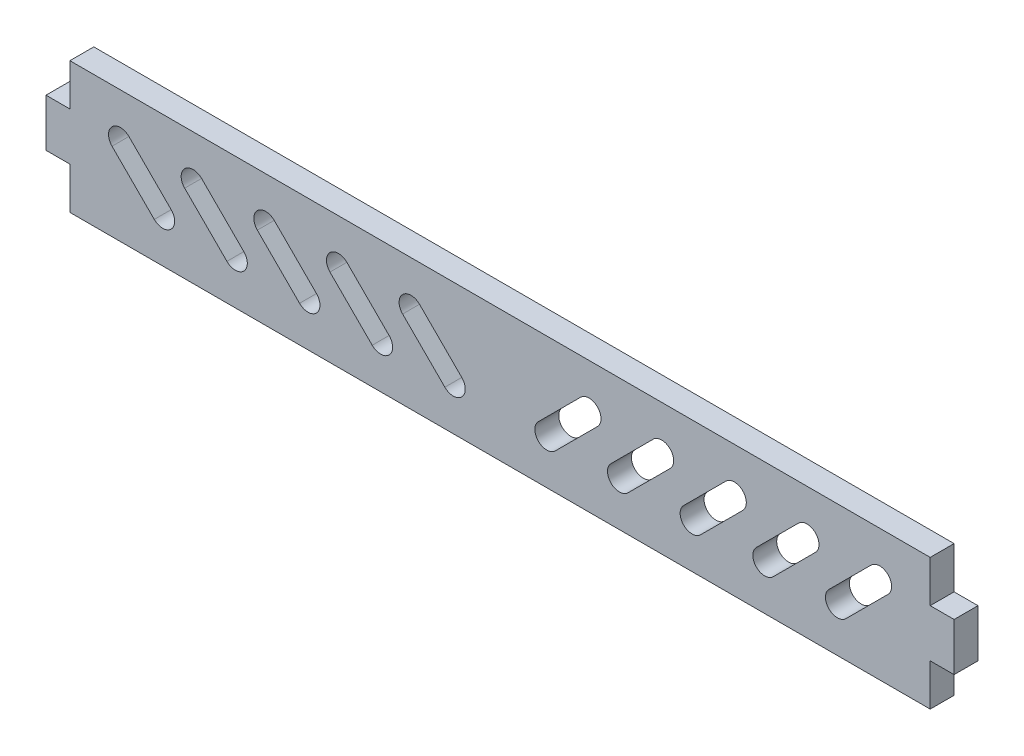
from build123d import *

# Parameters (mm, degrees)
BOSS_EXTRUDE1_DEPTH = 3.175
CUT_EXTRUDE1_DEPTH  = 119.807892511


with BuildPart() as part:
    # Sketch1 → Boss-Extrude1 (new body)
    with BuildSketch(Plane.XY):
        Polygon((0, 0), (-114.3, 0), (-114.3, 5.555107), (-117.475, 5.555107), (-117.475, 11.905107), (-114.3, 11.905107), (-114.3, 17.460214), (0, 17.460214), (0, 11.905107), (3.175, 11.905107), (3.175, 5.555107), (0, 5.555107), align=None)
    extrude(amount=BOSS_EXTRUDE1_DEPTH)

    # Sketch2 → Cut-Extrude1 (cut, through all)
    with BuildSketch(Plane.XY.offset(3.175)):
        with BuildLine():
            Line((-106.458798023, 12.658969053), (-100.846137947, 7.046308977))
            ThreePointArc((-100.846137947, 7.046308977), (-100.846137947, 4.801244947), (-103.091201977, 4.801244947))
            Line((-103.091201977, 4.801244947), (-108.703862053, 10.413905023))
            ThreePointArc((-108.703862053, 10.413905023), (-108.703862053, 12.658969053), (-106.458798023, 12.658969053))
        make_face()
        with BuildLine():
            Line((-96.806798023, 12.658969053), (-91.194137947, 7.046308977))
            ThreePointArc((-91.194137947, 7.046308977), (-91.194137947, 4.801244947), (-93.439201977, 4.801244947))
            Line((-93.439201977, 4.801244947), (-99.051862053, 10.413905023))
            ThreePointArc((-99.051862053, 10.413905023), (-99.051862053, 12.658969053), (-96.806798023, 12.658969053))
        make_face()
        with BuildLine():
            Line((-87.154798023, 12.658969053), (-81.542137947, 7.046308977))
            ThreePointArc((-81.542137947, 7.046308977), (-81.542137947, 4.801244947), (-83.787201977, 4.801244947))
            Line((-83.787201977, 4.801244947), (-89.399862053, 10.413905023))
            ThreePointArc((-89.399862053, 10.413905023), (-89.399862053, 12.658969053), (-87.154798023, 12.658969053))
        make_face()
        with BuildLine():
            Line((-77.502798023, 12.658969053), (-71.890137947, 7.046308977))
            ThreePointArc((-71.890137947, 7.046308977), (-71.890137947, 4.801244947), (-74.135201977, 4.801244947))
            Line((-74.135201977, 4.801244947), (-79.747862053, 10.413905023))
            ThreePointArc((-79.747862053, 10.413905023), (-79.747862053, 12.658969053), (-77.502798023, 12.658969053))
        make_face()
        with BuildLine():
            Line((-67.850798023, 12.658969053), (-62.238137947, 7.046308977))
            ThreePointArc((-62.238137947, 7.046308977), (-62.238137947, 4.801244947), (-64.483201977, 4.801244947))
            Line((-64.483201977, 4.801244947), (-70.095862053, 10.413905023))
            ThreePointArc((-70.095862053, 10.413905023), (-70.095862053, 12.658969053), (-67.850798023, 12.658969053))
        make_face()
        with BuildLine():
            Line((-46.449201977, 12.658969053), (-52.061862053, 7.046308977))
            ThreePointArc((-52.061862053, 7.046308977), (-52.061862053, 4.801244947), (-49.816798023, 4.801244947))
            Line((-49.816798023, 4.801244947), (-44.204137947, 10.413905023))
            ThreePointArc((-44.204137947, 10.413905023), (-44.204137947, 12.658969053), (-46.449201977, 12.658969053))
        make_face()
        with BuildLine():
            Line((-36.797201977, 12.658969053), (-42.409862053, 7.046308977))
            ThreePointArc((-42.409862053, 7.046308977), (-42.409862053, 4.801244947), (-40.164798023, 4.801244947))
            Line((-40.164798023, 4.801244947), (-34.552137947, 10.413905023))
            ThreePointArc((-34.552137947, 10.413905023), (-34.552137947, 12.658969053), (-36.797201977, 12.658969053))
        make_face()
        with BuildLine():
            Line((-27.145201977, 12.658969053), (-32.757862053, 7.046308977))
            ThreePointArc((-32.757862053, 7.046308977), (-32.757862053, 4.801244947), (-30.512798023, 4.801244947))
            Line((-30.512798023, 4.801244947), (-24.900137947, 10.413905023))
            ThreePointArc((-24.900137947, 10.413905023), (-24.900137947, 12.658969053), (-27.145201977, 12.658969053))
        make_face()
        with BuildLine():
            Line((-17.493201977, 12.658969053), (-23.105862053, 7.046308977))
            ThreePointArc((-23.105862053, 7.046308977), (-23.105862053, 4.801244947), (-20.860798023, 4.801244947))
            Line((-20.860798023, 4.801244947), (-15.248137947, 10.413905023))
            ThreePointArc((-15.248137947, 10.413905023), (-15.248137947, 12.658969053), (-17.493201977, 12.658969053))
        make_face()
        with BuildLine():
            Line((-7.841201977, 12.658969053), (-13.453862053, 7.046308977))
            ThreePointArc((-13.453862053, 7.046308977), (-13.453862053, 4.801244947), (-11.208798023, 4.801244947))
            Line((-11.208798023, 4.801244947), (-5.596137947, 10.413905023))
            ThreePointArc((-5.596137947, 10.413905023), (-5.596137947, 12.658969053), (-7.841201977, 12.658969053))
        make_face()
    extrude(amount=-CUT_EXTRUDE1_DEPTH, mode=Mode.SUBTRACT)


solid = part.part
